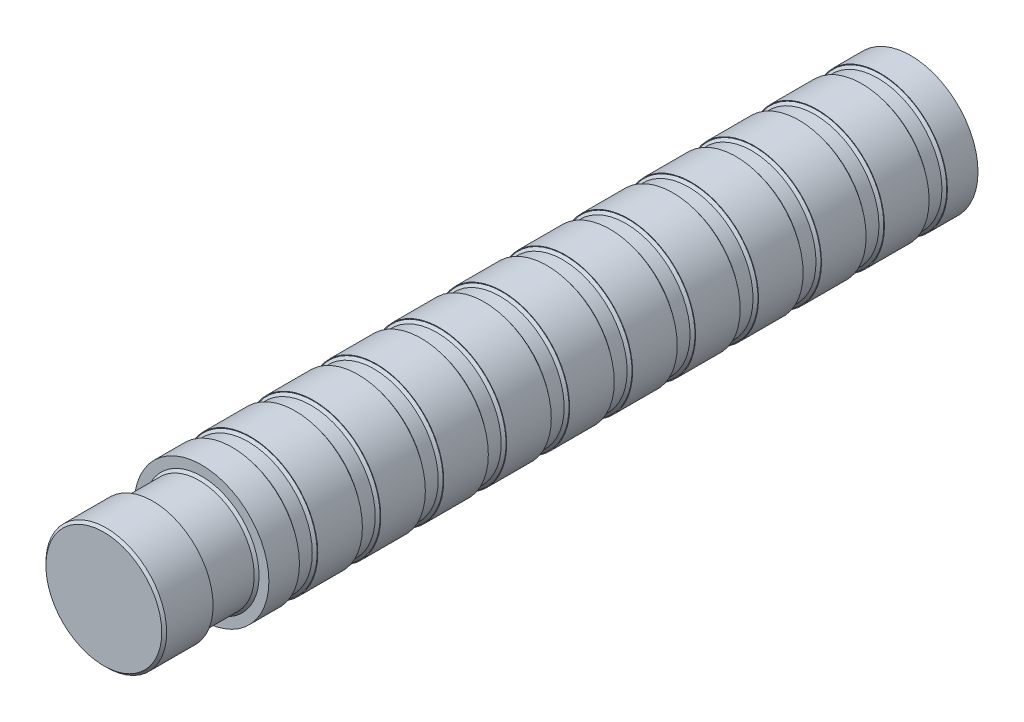
from build123d import *

# Parameters (mm, degrees)
CUT_EXTRUDE1_DEPTH  = 14
SKETCH5_R           = 4.5
BOSS_EXTRUDE1_DEPTH = 4
SKETCH6_R           = 4.9375
BOSS_EXTRUDE2_DEPTH = 4
CHAMFER1_SIZE       = 0.2


with BuildPart() as part:
    # Sketch2 → Revolve2 (revolve)
    with BuildSketch(Plane(origin=(0, 0, 0), x_dir=(0, 0, -1), z_dir=(1, 0, 0))):
        Polygon((-29, 0), (29, 0), (29, 5.5), (26.5, 5.5), (26.5, 5.25), (25, 5.25), (25, 5.5), (21.35, 5.5), (21.35, 5.25), (19.85, 5.25), (19.85, 5.5), (16.2, 5.5), (16.2, 5.25), (14.7, 5.25), (14.7, 5.5), (11.05, 5.5), (11.05, 5.25), (9.55, 5.25), (9.55, 5.5), (5.9, 5.5), (5.9, 5.25), (4.4, 5.25), (4.4, 5.5), (0.75, 5.5), (0.75, 5.25), (-0.75, 5.25), (-0.75, 5.5), (-4.4, 5.5), (-4.4, 5.25), (-5.9, 5.25), (-5.9, 5.5), (-9.55, 5.5), (-9.55, 5.25), (-11.05, 5.25), (-11.05, 5.5), (-14.7, 5.5), (-14.7, 5.25), (-16.2, 5.25), (-16.2, 5.5), (-19.85, 5.5), (-19.85, 5.25), (-21.35, 5.25), (-21.35, 5.5), (-25, 5.5), (-25, 5.25), (-26.5, 5.25), (-26.5, 5.5), (-29, 5.5), align=None)
    revolve(axis=Axis((0, 0, -29), (0, 0, -1)))

    # Sketch3 → Cut-Extrude1 (cut)
    with BuildSketch(Plane(origin=(0, 0, -29), x_dir=(-1, 0, 0), z_dir=(0, 0, -1))):
        with BuildLine():
            Line((1.475, 1.529705854), (1.475, -1.529705854))
            ThreePointArc((1.475, -1.529705854), (-2.125, 0), (1.475, 1.529705854))
        make_face()
    extrude(amount=-CUT_EXTRUDE1_DEPTH, mode=Mode.SUBTRACT)

    # Sketch5 → Boss-Extrude1 (add)
    with BuildSketch(Plane.XY.offset(29)):
        Circle(SKETCH5_R)
    extrude(amount=BOSS_EXTRUDE1_DEPTH)

    # Sketch6 → Boss-Extrude2 (add)
    with BuildSketch(Plane.XY.offset(33)):
        Circle(SKETCH6_R)
    extrude(amount=BOSS_EXTRUDE2_DEPTH)

    # Chamfer1
    chamfer1_edges = [part.edges().sort_by_distance(p)[0] for p in [
        (-4.9375, 0, 37),
        (-4.5, 0, 29),
        (-4.5, 0, 33),
        (0, -5.25, 26.5),
        (0, -5.25, 25),
        (0, -5.25, 19.85),
        (0, -5.25, 21.35),
        (0, -5.25, -26.5),
        (0, -5.25, -25),
        (0, -5.25, -21.35),
        (0, -5.25, -19.85),
        (0, -5.25, -16.2),
        (0, -5.25, -14.7),
        (0, -5.25, -11.05),
        (0, -5.25, -9.55),
        (0, -5.25, -5.9),
        (0, -5.25, -4.4),
        (0, -5.25, -0.75),
        (0, -5.25, 0.75),
        (0, -5.25, 4.4),
        (0, -5.25, 5.9),
        (0, -5.25, 9.55),
        (0, -5.25, 11.05),
        (0, -5.25, 14.7),
        (0, -5.25, 16.2),
    ]]
    chamfer(chamfer1_edges, length=CHAMFER1_SIZE)


solid = part.part
